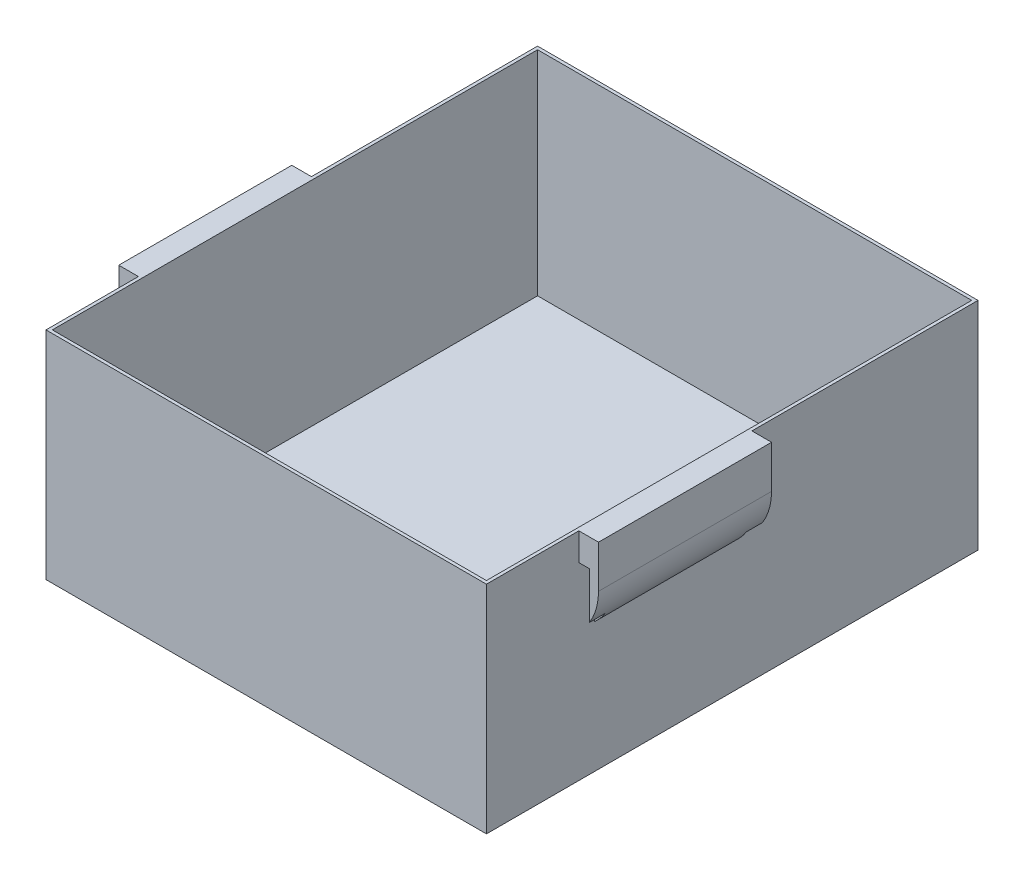
from build123d import *

# Parameters (mm, degrees)
SKETCH1_W           = 112
SKETCH1_H           = 125
BOSS_EXTRUDE1_DEPTH = 55
SKETCH2_W           = 110.4
SKETCH2_H           = 123.4
CUT_EXTRUDE1_DEPTH  = 54.2
SKETCH3_W           = 44
SKETCH3_H           = 22
BOSS_EXTRUDE2_DEPTH = 5
SKETCH4_W           = 2.65
SKETCH4_H           = 15
CUT_EXTRUDE2_DEPTH  = 4
SKETCH6_W           = 2.65
SKETCH6_H           = 15
CUT_EXTRUDE3_DEPTH  = 4
FILLET1_R           = 15
FILLET2_R           = 15


with BuildPart() as part:
    # Sketch1 → Boss-Extrude1 (new body)
    with BuildSketch(Plane(origin=(0, 0, 0), x_dir=(1, 0, 0), z_dir=(0, 1, 0))):
        Rectangle(SKETCH1_W, SKETCH1_H)
    extrude(amount=BOSS_EXTRUDE1_DEPTH)

    # Sketch2 → Cut-Extrude1 (cut)
    with BuildSketch(Plane(origin=(0, 55, 0), x_dir=(1, 0, 0), z_dir=(0, 1, 0))):
        Rectangle(SKETCH2_W, SKETCH2_H)
    extrude(amount=-CUT_EXTRUDE1_DEPTH, mode=Mode.SUBTRACT)

    # Sketch3 → Boss-Extrude2 (add)
    with BuildSketch(Plane(origin=(56, 0, 0), x_dir=(0, 0, -1), z_dir=(1, 0, 0))):
        with Locations((-17, 44)):
            Rectangle(SKETCH3_W, SKETCH3_H)
    boss_extrude2 = extrude(amount=BOSS_EXTRUDE2_DEPTH)

    # Sketch4 → Cut-Extrude2 (cut)
    with BuildSketch(Plane.XY.offset(39)):
        with Locations((57.325, 40.5)):
            Rectangle(SKETCH4_W, SKETCH4_H)
    cut_extrude2 = extrude(amount=-CUT_EXTRUDE2_DEPTH, mode=Mode.SUBTRACT)

    # Sketch6 → Cut-Extrude3 (cut)
    with BuildSketch(Plane(origin=(0, 0, -5), x_dir=(-1, 0, 0), z_dir=(0, 0, -1))):
        with Locations((-57.325, 40.5)):
            Rectangle(SKETCH6_W, SKETCH6_H)
    cut_extrude3 = extrude(amount=-CUT_EXTRUDE3_DEPTH, mode=Mode.SUBTRACT)

    # Mirror5: Boss-Extrude2 across plane
    add(boss_extrude2.mirror(Plane(origin=(0, 0, 0), x_dir=(0, 0, 1), z_dir=(1, 0, 0))))

    # Mirror6: Cut-Extrude2 across plane
    add(cut_extrude2.mirror(Plane(origin=(0, 0, 0), x_dir=(0, 0, 1), z_dir=(1, 0, 0))), mode=Mode.SUBTRACT)

    # Mirror7: Cut-Extrude3 across plane
    add(cut_extrude3.mirror(Plane(origin=(0, 0, 0), x_dir=(0, 0, 1), z_dir=(1, 0, 0))), mode=Mode.SUBTRACT)

    # Fillet1
    # the kernel refuses this fillet: 15 mm, written as the material it takes off along each edge
    with BuildSketch(Plane(origin=(61, 33, -32.950849719), x_dir=(-1, 0, 0), z_dir=(0, 0, 1))) as fillet1_piece_1:
        with BuildLine():
            CenterArc((15, -11.180339887), FILLET1_R, 131.810314896, 48.189685104)
            Line((0, -11.180339887), (-0.3, -11.180339887))
            Line((-0.3, -11.180339887), (-0.3, 0))
            Line((-0.3, 0), (0, 0.3))
            ThreePointArc((0, 0.3), (2.5, 0.3), (4.8, 0.223606798))
            Line((4.8, 0.223606798), (5, 0))
        make_face()
    extrude(amount=99.901699437, mode=Mode.SUBTRACT)

    # Fillet2
    # the kernel refuses this fillet: 15 mm, written as the material it takes off along each edge
    with BuildSketch(Plane(origin=(-61, 33, -32.950849719), x_dir=(1, 0, 0), z_dir=(0, 0, 1))) as fillet2_piece_1:
        with BuildLine():
            CenterArc((15, 11.180339887), FILLET2_R, 180, 48.189685104)
            Line((0, 11.180339887), (-0.3, 11.180339887))
            Line((-0.3, 11.180339887), (-0.3, 0))
            Line((-0.3, 0), (0, -0.3))
            ThreePointArc((0, -0.3), (2.5, -0.3), (4.8, -0.223606798))
            Line((4.8, -0.223606798), (5, 0))
        make_face()
    extrude(amount=99.901699437, mode=Mode.SUBTRACT)


solid = part.part
